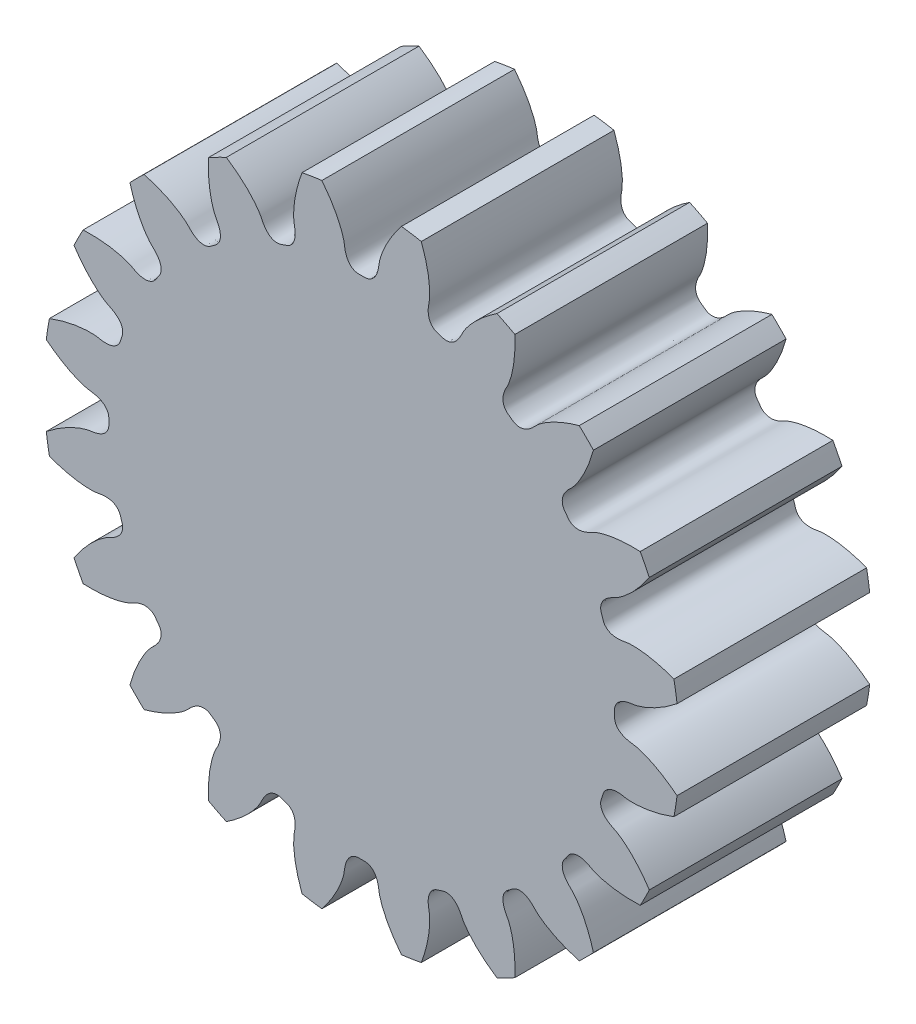
from build123d import *

# Parameters (mm, degrees)
SKETCHREVOLVESPURASSEMBLY01PINION_W       = 10
SKETCHREVOLVESPURASSEMBLY01PINION_H       = 16.499999752
TOOTHEXTRUDECUTSPURASSEMBLY01PINION_DEPTH = 5
PATTERNSPURASSEMBLY01PINION_COUNT         = 20


with BuildPart() as part:
    # SketchRevolveSpurAssembly01Pinion → SpurAssembly01Pinion (revolve)
    with BuildSketch(Plane(origin=(0, 0, 0), x_dir=(0, 0, -1), z_dir=(1, 0, 0))):
        with Locations((0, 8.249999876)):
            Rectangle(SKETCHREVOLVESPURASSEMBLY01PINION_W, SKETCHREVOLVESPURASSEMBLY01PINION_H)
    revolve(axis=Axis((0, 0, 0), (0, 0, -1)))

    # SketchToothSpurAssembly01Pinion → ToothExtrudeCutSpurAssembly01Pinion (cut, symmetric)
    with BuildSketch(Plane.XY):
        with BuildLine():
            ThreePointArc((16.438815928, 2.120364973), (16.574999751, 0), (16.438815928, -2.120364973))
            add(Edge.make_bspline(
                [(16.438815928, -2.120364973), (16.306213447, -2.012632117), (16.10792267, -1.860929635), (15.841705586, -1.676668952), (15.654853966, -1.55570694), (15.475899367, -1.447553762), (15.305444286, -1.351598726), (15.144060802, -1.267206194), (14.992289617, -1.193717223), (14.850639167, -1.130450865), (14.719584807, -1.0767054), (14.599567969, -1.031760257), (14.490995634, -0.99487577), (14.394239041, -0.965299916), (14.309634999, -0.942253529), (14.237479548, -0.924980687), (14.178044201, -0.912608864), (14.049223501, -0.890261122), (13.912281496, -0.878231728), (13.769652297, -0.842658369), (13.695599357, -0.820644128), (13.624377747, -0.794966749), (13.555692175, -0.765356143), (13.489258635, -0.731124882), (13.424830796, -0.691333031), (13.362331646, -0.644635632), (13.30209452, -0.589245233), (13.24524803, -0.523019137), (13.194309632, -0.443877425), (13.153279262, -0.350864326), (13.130262908, -0.253354669), (13.120821868, -0.134969136), (13.12767395, 0), (13.120821868, 0.134969136), (13.130262908, 0.253354669), (13.153279262, 0.350864326), (13.194309632, 0.443877425), (13.24524803, 0.523019137), (13.30209452, 0.589245233), (13.362331646, 0.644635632), (13.424830796, 0.691333031), (13.489258635, 0.731124882), (13.555692175, 0.765356143), (13.624377747, 0.794966749), (13.695599357, 0.820644128), (13.769652297, 0.842658369), (13.912281496, 0.878231728), (14.049223501, 0.890261122), (14.178044201, 0.912608864), (14.237479548, 0.924980687), (14.309634999, 0.942253529), (14.394239041, 0.965299916), (14.490995634, 0.99487577), (14.599567969, 1.031760257), (14.719584807, 1.0767054), (14.850639167, 1.130450865), (14.992289617, 1.193717223), (15.144060802, 1.267206194), (15.305444286, 1.351598726), (15.475899367, 1.447553762), (15.654853966, 1.55570694), (15.841705586, 1.676668952), (16.10792267, 1.860929635), (16.306213447, 2.012632117), (16.438815928, 2.120364973)],
                knots=[0, 0, 0, 0, 0.061422842, 0.089709677, 0.116380121, 0.141434175, 0.164871838, 0.186693111, 0.206897994, 0.225486485, 0.242458587, 0.257814298, 0.271553618, 0.283676548, 0.294183087, 0.303073236, 0.310346995, 0.316004363, 0.350076802, 0.359567688, 0.36880314, 0.37784437, 0.386769007, 0.395675631, 0.404688756, 0.413962948, 0.423682731, 0.434051196, 0.445255861, 0.457401439, 0.47041984, 0.481066796, 0.5, 0.518933204, 0.52958016, 0.542598561, 0.554744139, 0.565948804, 0.576317269, 0.586037052, 0.595311244, 0.604324369, 0.613230993, 0.62215563, 0.63119686, 0.640432312, 0.649923198, 0.683995637, 0.689653005, 0.696926764, 0.705816913, 0.716323452, 0.728446382, 0.742185702, 0.757541413, 0.774513515, 0.793102006, 0.813306889, 0.835128162, 0.858565825, 0.883619879, 0.910290323, 0.938577158, 1, 1, 1, 1], degree=3))
        make_face()
    toothextrudecutspurassembly01pinion = extrude(amount=TOOTHEXTRUDECUTSPURASSEMBLY01PINION_DEPTH, both=True, mode=Mode.SUBTRACT)

    # PatternSpurAssembly01Pinion: ToothExtrudeCutSpurAssembly01Pinion ×20 about axis
    patternspurassembly01pinion_axis = Axis((0, 0, 55), (0, 0, -1))
    for i in range(1, PATTERNSPURASSEMBLY01PINION_COUNT):
        add(toothextrudecutspurassembly01pinion.rotate(patternspurassembly01pinion_axis, i * 360 / PATTERNSPURASSEMBLY01PINION_COUNT), mode=Mode.SUBTRACT)


solid = part.part
